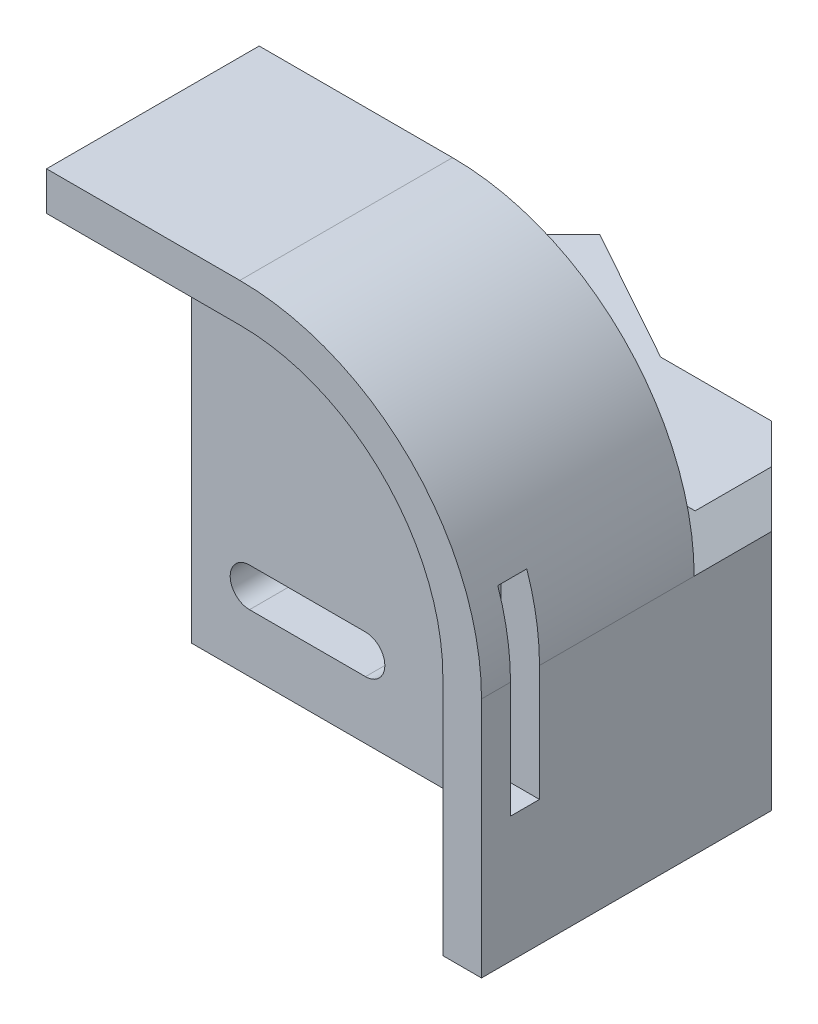
from build123d import *

# Parameters (mm, degrees)
BOSS_EXTRUDE1_DEPTH      = 7
EXTRUDE_THIN2_DEPTH      = 15
FILLET1_R                = 7
SKETCH5_W                = 15
SKETCH5_H                = 25
BOSS_EXTRUDE2_DEPTH      = 8
CUT_EXTRUDE2_DEPTH       = 42.641325627
LPATTERN1_COUNT          = 2
LPATTERN1_PITCH          = 26
CHAMFER3_SIZE            = 7
SKETCH9_W                = 15
SKETCH9_H                = 7
BOSS_EXTRUDE3_DEPTH      = 15
BOSS_EXTRUDE4_DEPTH      = 2
BOSS_EXTRUDE4_DEPTH_BACK = 9.9
SKETCH13_W               = 8
SKETCH13_H               = 2
BOSS_EXTRUDE6_DEPTH      = 6
CHAMFER6_SIZE            = 23.744712882
CHAMFER6_SIZE_2          = 13.5
CHAMFER7_SIZE            = 3
SKETCH14_R               = 1.5
CUT_EXTRUDE3_DEPTH       = 15
SKETCH15_W               = 15
SKETCH15_H               = 8.5
CUT_EXTRUDE4_DEPTH       = 6
CHAMFER8_SIZE            = 8
SKETCH16_W               = 3
SKETCH16_H               = 20
CUT_EXTRUDE5_DEPTH       = 54.176035971


with BuildPart() as part:
    # Sketch1 → Boss-Extrude1 (new body)
    with BuildSketch(Plane.XY):
        with BuildLine():
            Line((0, 25), (-20, 25))
            Line((-20, 25), (-20, -25))
            Line((-20, -25), (25, -25))
            Line((25, -25), (25, 0))
            ThreePointArc((25, 0), (17.67766953, 17.67766953), (0, 25))
        make_face()
    extrude(amount=BOSS_EXTRUDE1_DEPTH)

    # Sketch3 → Extrude-Thin2 (add)
    with BuildSketch(Plane.XY.offset(7)):
        with BuildLine():
            Line((25, -25), (25, 0))
            ThreePointArc((25, 0), (17.67766953, 17.67766953), (0, 25))
            Line((0, 25), (-20, 25))
            Line((-20, 25), (-20, 21))
            Line((-20, 21), (0, 21))
            ThreePointArc((0, 21), (14.849242405, 14.849242405), (21, 0))
            Line((21, 0), (21, -25))
            Line((21, -25), (25, -25))
        make_face()
    extrude(amount=EXTRUDE_THIN2_DEPTH)

    # Fillet1
    fillet1_edges = [part.edges().sort_by_distance(p)[0] for p in [
        (21, -12.5, 7),
        (14.849242405, 14.849242405, 7),
        (-10, 21, 7),
    ]]
    fillet(fillet1_edges, radius=FILLET1_R)

    # Sketch5 → Boss-Extrude2 (add)
    with BuildSketch(Plane(origin=(25, 0, 0), x_dir=(0, 0, -1), z_dir=(1, 0, 0))):
        with Locations((7.5, -12.5)):
            Rectangle(SKETCH5_W, SKETCH5_H)
    extrude(amount=-BOSS_EXTRUDE2_DEPTH)

    # Sketch8 → Cut-Extrude2 (cut, through all)
    with BuildSketch(Plane.XY.offset(7)):
        with BuildLine():
            Line((-14, -15), (-2, -15))
            ThreePointArc((-2, -15), (0, -17), (-2, -19))
            Line((-2, -19), (-14, -19))
            ThreePointArc((-14, -19), (-16, -17), (-14, -15))
        make_face()
    cut_extrude2 = extrude(amount=-CUT_EXTRUDE2_DEPTH, mode=Mode.SUBTRACT)

    # LPattern1: Cut-Extrude2 ×2
    with Locations(*[(0, i * LPATTERN1_PITCH, 0) for i in range(1, LPATTERN1_COUNT)]):
        add(cut_extrude2, mode=Mode.SUBTRACT)

    # Chamfer3
    chamfer3_edges = [part.edges().sort_by_distance(p)[0] for p in [
        (25, -12.5, -15),
    ]]
    chamfer(chamfer3_edges, length=CHAMFER3_SIZE)

    # Sketch9 → Boss-Extrude3 (add)
    with BuildSketch(Plane.ZY.offset(-17)):
        with Locations((-7.5, -3.5)):
            Rectangle(SKETCH9_W, SKETCH9_H)
    extrude(amount=BOSS_EXTRUDE3_DEPTH)

    # Sketch10 → Boss-Extrude4 (add, two sides: drawn at the far end of the back side and taken through both)
    with BuildSketch(Plane.XZ.offset(7).offset(-BOSS_EXTRUDE4_DEPTH_BACK)):
        Polygon((2, -15), (-6.970562748, -15), (-12.627416998, -9.343145751), (-16.870057685, -13.585786438), (-20, -10.455844123), (-20, 0), (17, 0), (17, -15), align=None)
        Polygon((-4.849242405, -10.050252532), (-9.091883092, -5.807611845), (-6.970562748, -3.686291501), (-2.727922061, -7.928932188), align=None, mode=Mode.SUBTRACT)
    extrude(amount=BOSS_EXTRUDE4_DEPTH + BOSS_EXTRUDE4_DEPTH_BACK)

    # Sketch13 → Boss-Extrude6 (add)
    with BuildSketch(Plane(origin=(-10.985281374, 0, -10.985281374), x_dir=(-0.7071067811865478, 0, 0.7071067811865472), z_dir=(-0.7071067811865472, 0, -0.7071067811865478))):
        with Locations((-1.67766953, 1.9)):
            Rectangle(SKETCH13_W, SKETCH13_H)
        with Locations((-1.67766953, -8)):
            Rectangle(SKETCH13_W, SKETCH13_H)
    extrude(amount=BOSS_EXTRUDE6_DEPTH)

    # Chamfer6
    # the kernel refuses this chamfer: 23.744712882, 13.5 mm, written as the material it adds along each edge
    with BuildSketch(Plane(origin=(-6.970562748, -9, -15), x_dir=(-0.7145740403020574, 0, -0.6995598194053126), z_dir=(0, 1, 0))) as chamfer6_piece_1_section:
        Polygon((CHAMFER6_SIZE * 0.999943641689, -CHAMFER6_SIZE * 0.0106166574102), (-CHAMFER6_SIZE_2 * 0.714574040302, -CHAMFER6_SIZE_2 * 0.699559819405), (0, 0), align=None)
    chamfer6_piece_1 = extrude(amount=2, mode=Mode.PRIVATE)
    chamfer6_piece_1 = split(chamfer6_piece_1, bisect_by=Plane(origin=(-9.095447466, -8, -21.360396657), z_dir=(0.7071067811865476, 0, 0.7071067811865476)), keep=Keep.TOP, mode=Mode.PRIVATE)
    add(chamfer6_piece_1)
    with BuildSketch(Plane(origin=(-6.970562748, -70.647744863, -15), x_dir=(-0.7145740403020574, 0, -0.6995598194053126), z_dir=(0, 1, 0))) as chamfer6_piece_2_section:
        Polygon((CHAMFER6_SIZE * 0.999943641689, -CHAMFER6_SIZE * 0.0106166574102), (-CHAMFER6_SIZE_2 * 0.714574040302, -CHAMFER6_SIZE_2 * 0.699559819405), (0, 0), align=None)
    chamfer6_piece_2 = extrude(amount=125.295489727, mode=Mode.PRIVATE)
    chamfer6_piece_2 = split(chamfer6_piece_2, bisect_by=Plane(origin=(-6.871868761, 2.9, -19.136817952), z_dir=(0, -1, 0)), keep=Keep.TOP, mode=Mode.PRIVATE)
    chamfer6_piece_2 = split(chamfer6_piece_2, bisect_by=Plane(origin=(-6.871868761, 0.9, -19.136817952), z_dir=(0, 1, 0)), keep=Keep.TOP, mode=Mode.PRIVATE)
    chamfer6_piece_2 = split(chamfer6_piece_2, bisect_by=Plane(origin=(-9.095447466, 1.9, -21.360396657), z_dir=(0.7071067811865476, 0, 0.7071067811865476)), keep=Keep.TOP, mode=Mode.PRIVATE)
    add(chamfer6_piece_2)
    with BuildSketch(Plane(origin=(-6.970562748, -60.747744863, -15), x_dir=(-0.7145740403020574, 0, -0.6995598194053126), z_dir=(0, 1, 0))) as chamfer6_piece_3_section:
        Polygon((CHAMFER6_SIZE * 0.999943641689, -CHAMFER6_SIZE * 0.0106166574102), (-CHAMFER6_SIZE_2 * 0.714574040302, -CHAMFER6_SIZE_2 * 0.699559819405), (0, 0), align=None)
    chamfer6_piece_3 = extrude(amount=125.295489727, mode=Mode.PRIVATE)
    chamfer6_piece_3 = split(chamfer6_piece_3, bisect_by=Plane(origin=(-6.871868761, -7, -19.136817952), z_dir=(0, -1, 0)), keep=Keep.TOP, mode=Mode.PRIVATE)
    chamfer6_piece_3 = split(chamfer6_piece_3, bisect_by=Plane(origin=(-9.095447466, -8, -21.360396657), z_dir=(0.7071067811865476, 0, 0.7071067811865476)), keep=Keep.TOP, mode=Mode.PRIVATE)
    chamfer6_piece_3 = split(chamfer6_piece_3, bisect_by=Plane(origin=(-6.871868761, -9, -19.136817952), z_dir=(0, 1, 0)), keep=Keep.TOP, mode=Mode.PRIVATE)
    add(chamfer6_piece_3)
    with BuildSketch(Plane(origin=(-6.970562748, 0.9, -15), x_dir=(-0.7145740403020574, 0, -0.6995598194053126), z_dir=(0, 1, 0))) as chamfer6_piece_4_section:
        Polygon((CHAMFER6_SIZE * 0.999943641689, -CHAMFER6_SIZE * 0.0106166574102), (-CHAMFER6_SIZE_2 * 0.714574040302, -CHAMFER6_SIZE_2 * 0.699559819405), (0, 0), align=None)
    chamfer6_piece_4 = extrude(amount=2, mode=Mode.PRIVATE)
    chamfer6_piece_4 = split(chamfer6_piece_4, bisect_by=Plane(origin=(-9.095447466, 1.9, -21.360396657), z_dir=(0.7071067811865476, 0, 0.7071067811865476)), keep=Keep.TOP, mode=Mode.PRIVATE)
    add(chamfer6_piece_4)

    # Chamfer7
    chamfer7_edges = [part.edges().sort_by_distance(p)[0] for p in [
        (-1.5, 2.9, 0),
        (17, -9, -7.5),
        (17, -17, 0),
        (-1.5, -9, 0),
    ]]
    chamfer(chamfer7_edges, length=CHAMFER7_SIZE)

    # Sketch14 → Cut-Extrude3 (cut)
    with BuildSketch(Plane(origin=(-10.985281374, 0, -10.985281374), x_dir=(-0.7071067811865478, 0, 0.7071067811865472), z_dir=(-0.7071067811865472, 0, -0.7071067811865478))):
        with Locations((-0.67766953, -3.05)):
            Circle(SKETCH14_R)
    extrude(amount=-CUT_EXTRUDE3_DEPTH, mode=Mode.SUBTRACT)

    # Sketch15 → Cut-Extrude4 (cut)
    with BuildSketch(Plane(origin=(-15.227922061, 0, -15.227922061), x_dir=(-0.7071067811865475, 0, 0.7071067811865477), z_dir=(-0.7071067811865477, 0, -0.7071067811865475))):
        with Locations((-4.87766953, -3.05)):
            Rectangle(SKETCH15_W, SKETCH15_H)
    extrude(amount=-CUT_EXTRUDE4_DEPTH, mode=Mode.SUBTRACT)

    # Chamfer8
    # the kernel refuses this chamfer: 8 mm, written as the material it adds along each edge
    with BuildSketch(Plane(origin=(17, 0, 0), x_dir=(0.9996219169112968, -0.02749587661058649, 0), z_dir=(0, 0, -1))) as chamfer8_piece_1_section:
        Polygon((CHAMFER8_SIZE * 0.999621916911, -CHAMFER8_SIZE * 0.0274958766106), (-CHAMFER8_SIZE * 0.0274958766106, -CHAMFER8_SIZE * 0.999621916911), (0, 0), align=None)
    chamfer8_piece_1 = extrude(amount=15, mode=Mode.PRIVATE)
    chamfer8_piece_1 = split(chamfer8_piece_1, bisect_by=Plane(origin=(25, 1.068527792, -2.415736104), z_dir=(-1, 0, 0)), keep=Keep.TOP, mode=Mode.PRIVATE)
    chamfer8_piece_1 = split(chamfer8_piece_1, bisect_by=Plane(origin=(20.463014023, 2.9, -2.415736104), z_dir=(0, -1, 0)), keep=Keep.TOP, mode=Mode.PRIVATE)
    chamfer8_piece_1 = split(chamfer8_piece_1, bisect_by=Plane(origin=(20.463014023, 2.276395844, -3.623604156), z_dir=(0, -0.7071067811865476, 0.7071067811865476)), keep=Keep.TOP, mode=Mode.PRIVATE)
    add(chamfer8_piece_1)
    with BuildSketch(Plane(origin=(17, 0, 20.573463904), x_dir=(0.9996219169112968, -0.02749587661058651, 0), z_dir=(0, 0, -1))) as chamfer8_piece_2_section:
        Polygon((CHAMFER8_SIZE * 0.999621916911, -CHAMFER8_SIZE * 0.0274958766106), (-CHAMFER8_SIZE * 0.0274958766106, -CHAMFER8_SIZE * 0.999621916911), (0, 0), align=None)
    chamfer8_piece_2 = extrude(amount=35.573463904, mode=Mode.PRIVATE)
    chamfer8_piece_2 = split(chamfer8_piece_2, bisect_by=Plane(origin=(17.28092154, 7.132229333, 0), z_dir=(0, 0, 1)), keep=Keep.TOP, mode=Mode.PRIVATE)
    chamfer8_piece_2 = split(chamfer8_piece_2, bisect_by=Plane(origin=(17.28092154, 6.824172, 0.924172), z_dir=(0, 0.7071067811865476, -0.7071067811865476)), keep=Keep.TOP, mode=Mode.PRIVATE)
    add(chamfer8_piece_2)
    with BuildSketch(Plane(origin=(17, 0, 0), x_dir=(0.9996219169112968, -0.02749587661058649, 0), z_dir=(0, 0, -1))) as chamfer8_piece_3_section:
        Polygon((CHAMFER8_SIZE * 0.999621916911, -CHAMFER8_SIZE * 0.0274958766106), (-CHAMFER8_SIZE * 0.0274958766106, -CHAMFER8_SIZE * 0.999621916911), (0, 0), align=None)
    chamfer8_piece_3 = extrude(amount=15, mode=Mode.PRIVATE)
    chamfer8_piece_3 = split(chamfer8_piece_3, bisect_by=Plane(origin=(19.029775324, 2.9, -1.05711343), z_dir=(0, 1, 0)), keep=Keep.TOP, mode=Mode.PRIVATE)
    chamfer8_piece_3 = split(chamfer8_piece_3, bisect_by=Plane(origin=(19.029775324, 4.314329856, -1.585670144), z_dir=(0, -0.7071067811865476, 0.7071067811865476)), keep=Keep.TOP, mode=Mode.PRIVATE)
    add(chamfer8_piece_3)
    with BuildSketch(Plane(origin=(17, 0, 0), x_dir=(0.9996219169112968, -0.02749587661058649, 0), z_dir=(0, 0, -1))) as chamfer8_piece_4_section:
        Polygon((CHAMFER8_SIZE * 0.999621916911, -CHAMFER8_SIZE * 0.0274958766106), (-CHAMFER8_SIZE * 0.0274958766106, -CHAMFER8_SIZE * 0.999621916911), (0, 0), align=None)
    chamfer8_piece_4 = extrude(amount=15, mode=Mode.PRIVATE)
    chamfer8_piece_4 = split(chamfer8_piece_4, bisect_by=Plane(origin=(21.997895662, 1.393550415, -11.002104338), z_dir=(-0.7071067811865476, 0, 0.7071067811865476)), keep=Keep.TOP, mode=Mode.PRIVATE)
    chamfer8_piece_4 = split(chamfer8_piece_4, bisect_by=Plane(origin=(25, 1.393550415, -8.795226249), z_dir=(-1, 0, 0)), keep=Keep.TOP, mode=Mode.PRIVATE)
    chamfer8_piece_4 = split(chamfer8_piece_4, bisect_by=Plane(origin=(19.791017572, 2.9, -8.795226249), z_dir=(0, -1, 0)), keep=Keep.TOP, mode=Mode.PRIVATE)
    chamfer8_piece_4 = split(chamfer8_piece_4, bisect_by=Plane(origin=(19.791017572, -0.750837917, -6.650837917), z_dir=(0, 0.7071067811865476, -0.7071067811865476)), keep=Keep.TOP, mode=Mode.PRIVATE)
    add(chamfer8_piece_4)

    # Sketch16 → Cut-Extrude5 (cut, through all)
    with BuildSketch(Plane.ZY.offset(-21)):
        with Locations((17.5, -2)):
            Rectangle(SKETCH16_W, SKETCH16_H)
    extrude(amount=-CUT_EXTRUDE5_DEPTH, mode=Mode.SUBTRACT)


solid = part.part
